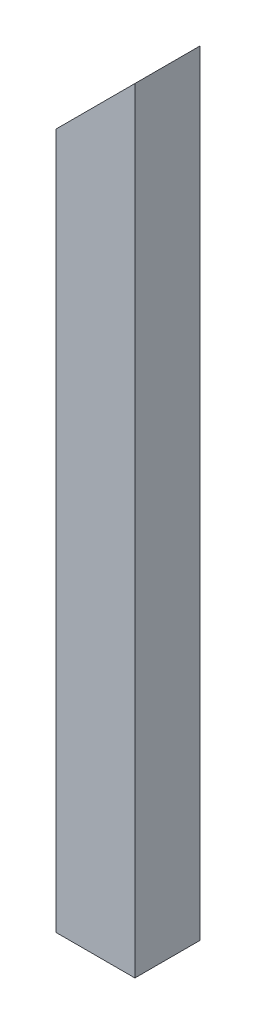
from build123d import *

# Parameters (mm, degrees)
BOSS_EXTRUDE1_DEPTH = 3.5
SHELL1_T            = -1


with BuildPart() as part:
    # Sketch2 → Boss-Extrude1 (new, symmetric)
    with BuildSketch(Plane.XY):
        Polygon((0, 0), (0, 75), (8.485281374, 83.485281374), (8.485281374, 0), align=None)
    extrude(amount=BOSS_EXTRUDE1_DEPTH, both=True)

    # Shell1
    shell1_openings = [part.faces().sort_by_distance(p)[0] for p in [
        (4.242640687, 0, 0),
        (4.242640687, 79.242640687, 0),
    ]]
    offset(amount=SHELL1_T, openings=shell1_openings, kind=Kind.INTERSECTION)


solid = part.part
